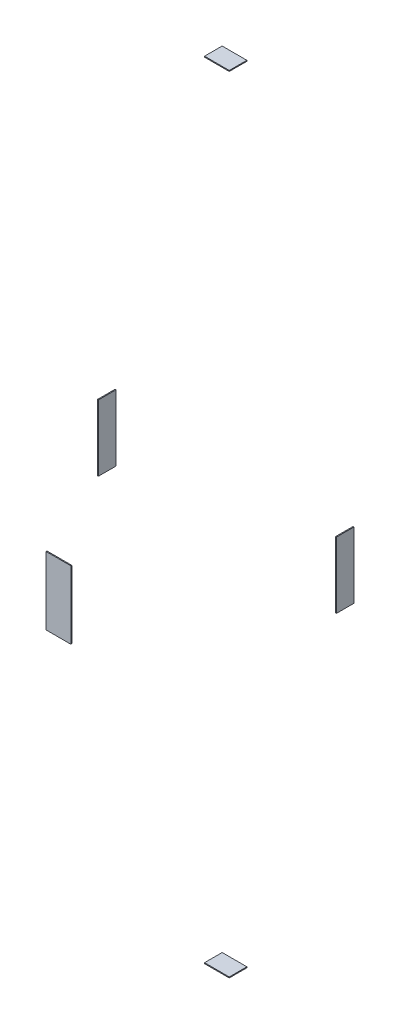
from build123d import *

# Parameters (mm, degrees)
SKETCH1_W            = 400
SKETCH1_H            = 300
BOSS_EXTRUDE1_DEPTH  = 1100
SHELL1_T             = -15
SPLIT2_START         = -6167.732568069
SPLIT2_OUTLINE_W     = 15
SPLIT2_OUTLINE_H     = 285
SPLIT2_DEPTH         = 1100
SPLIT2_2_OUTLINE_W   = 385
SPLIT2_2_OUTLINE_H   = 285
SPLIT2_2_DEPTH       = 15
SPLIT2_START_2       = -5082.732568069
SPLIT2_3_OUTLINE_W   = 385
SPLIT2_3_OUTLINE_H   = 285
SPLIT2_3_DEPTH       = 15
SPLIT2_START_3       = -6152.732568069
SPLIT2_4_OUTLINE_W   = 15
SPLIT2_4_OUTLINE_H   = 285
SPLIT2_4_DEPTH       = 1070
SPLIT2_5_OUTLINE_W   = 400
SPLIT2_5_OUTLINE_H   = 285
SPLIT2_5_DEPTH       = 15
SPLIT2_6_OUTLINE_W   = 400
SPLIT2_6_OUTLINE_H   = 285
SPLIT2_6_DEPTH       = 15
SCALE1_START         = -6275.660190895
SCALE1_OUTLINE_W     = 400
SCALE1_OUTLINE_H     = 285
SCALE1_OUTLINE_W_2   = 40
SCALE1_OUTLINE_H_2   = 28.5
SCALE1_OUTLINE_W_3   = 1.5
SCALE1_OUTLINE_H_3   = 15
SCALE1_OUTLINE_H_4   = 1.5
SCALE1_DEPTH         = 1286.002924444
SCALE1_START_2       = -6267.410190895
SCALE1_2_OUTLINE_W   = 1.5
SCALE1_2_OUTLINE_H   = 28.5
SCALE1_2_OUTLINE_W_2 = 40
SCALE1_2_OUTLINE_H_2 = 1.5
SCALE1_2_DEPTH       = 594.677622826
SCALE1_START_3       = -5562.732568069
SCALE1_3_OUTLINE_W   = 1.5
SCALE1_3_OUTLINE_H   = 28.5
SCALE1_3_OUTLINE_W_2 = 40
SCALE1_3_OUTLINE_H_2 = 1.5
SCALE1_3_DEPTH       = 564.825301618
SCALE1_4_OUTLINE_W   = 1.5
SCALE1_4_OUTLINE_H   = 28.5
SCALE1_4_OUTLINE_W_2 = 40
SCALE1_4_DEPTH       = 6.75
SCALE1_START_4       = -4996.407266451
SCALE1_5_OUTLINE_W   = 1.5
SCALE1_5_OUTLINE_H   = 28.5
SCALE1_5_OUTLINE_W_2 = 40
SCALE1_5_DEPTH       = 6.75
SCALE1_START_5       = -6268.910190895
SCALE1_6_OUTLINE_W   = 1.5
SCALE1_6_OUTLINE_H   = 28.5
SCALE1_6_DEPTH       = 597.677622826
SCALE1_START_6       = -5564.232568069
SCALE1_7_OUTLINE_W   = 1.5
SCALE1_7_OUTLINE_H   = 28.5
SCALE1_7_DEPTH       = 567.825301618


# Read off the part's stored shape, not the designer's step: Split2, Scale1
with BuildPart() as part:
    # Sketch1 → Boss-Extrude1 (new body)
    with BuildSketch(Plane(origin=(0, -6167.732568069, 0), x_dir=(1, 0, 0), z_dir=(0, 1, 0))):
        with Locations((-588.349422114, 459.224669701)):
            Rectangle(SKETCH1_W, SKETCH1_H)
    extrude(amount=BOSS_EXTRUDE1_DEPTH)

    # Shell1
    shell1_openings = [part.faces().sort_by_distance(p)[0] for p in [
        (-588.349422114, -5617.732568069, -609.224669701),
    ]]
    offset(amount=SHELL1_T, openings=shell1_openings, kind=Kind.INTERSECTION)


with BuildPart() as body_2:
    # Split1: the piece on the far side of the plane
    add(part.part)
    split(bisect_by=Plane(origin=(0, 0, -324.224669701), x_dir=(-1, 0, 0), z_dir=(0, 0, -1)), keep=Keep.BOTTOM)


with BuildPart() as part_1:
    add(part.part)

    # Split1
    split(bisect_by=Plane(origin=(0, 0, -324.224669701), x_dir=(-1, 0, 0), z_dir=(0, 0, -1)), keep=Keep.TOP)

    # Split2 outline → Split2 (cut)
    with BuildSketch(Plane(origin=(0, 0, 0), x_dir=(1, 0, 0), z_dir=(0, 1, 0)).offset(SPLIT2_START)):
        with Locations((-395.849422114, 466.724669701)):
            Rectangle(SPLIT2_OUTLINE_W, SPLIT2_OUTLINE_H)
    extrude(amount=SPLIT2_DEPTH, mode=Mode.SUBTRACT)

    # Split2 2 outline → Split2 2 (cut)
    with BuildSketch(Plane(origin=(0, 0, 0), x_dir=(1, 0, 0), z_dir=(0, 1, 0)).offset(SPLIT2_START)):
        with Locations((-595.849422114, 466.724669701)):
            Rectangle(SPLIT2_2_OUTLINE_W, SPLIT2_2_OUTLINE_H)
    extrude(amount=SPLIT2_2_DEPTH, mode=Mode.SUBTRACT)

    # Split2 3 outline → Split2 3 (cut)
    with BuildSketch(Plane(origin=(0, 0, 0), x_dir=(1, 0, 0), z_dir=(0, 1, 0)).offset(SPLIT2_START_2)):
        with Locations((-595.849422114, 466.724669701)):
            Rectangle(SPLIT2_3_OUTLINE_W, SPLIT2_3_OUTLINE_H)
    extrude(amount=SPLIT2_3_DEPTH, mode=Mode.SUBTRACT)


with BuildPart() as body_3:
    # Split2 4 outline → Split2 4 (new body)
    with BuildSketch(Plane(origin=(0, 0, 0), x_dir=(1, 0, 0), z_dir=(0, 1, 0)).offset(SPLIT2_START_3)):
        with Locations((-395.849422114, 466.724669701)):
            Rectangle(SPLIT2_4_OUTLINE_W, SPLIT2_4_OUTLINE_H)
    extrude(amount=SPLIT2_4_DEPTH)


with BuildPart() as body_4:
    # Split2 5 outline → Split2 5 (new body)
    with BuildSketch(Plane(origin=(0, 0, 0), x_dir=(1, 0, 0), z_dir=(0, 1, 0)).offset(SPLIT2_START)):
        with Locations((-588.349422114, 466.724669701)):
            Rectangle(SPLIT2_5_OUTLINE_W, SPLIT2_5_OUTLINE_H)
    extrude(amount=SPLIT2_5_DEPTH)


with BuildPart() as body_5:
    # Split2 6 outline → Split2 6 (new body)
    with BuildSketch(Plane(origin=(0, 0, 0), x_dir=(1, 0, 0), z_dir=(0, 1, 0)).offset(SPLIT2_START_2)):
        with Locations((-588.349422114, 466.724669701)):
            Rectangle(SPLIT2_6_OUTLINE_W, SPLIT2_6_OUTLINE_H)
    extrude(amount=SPLIT2_6_DEPTH)


with BuildPart() as body_2_1:
    # Body-Move/Copy1: moved
    add(body_2.part.moved(Location((0, 0, 119.961763837))))


with BuildPart() as body_5_1:
    # Body-Move/Copy2: moved
    add(body_5.part.moved(Location((0, 78.075301619, 0))))


with BuildPart() as body_4_1:
    # Body-Move/Copy3: moved
    add(body_4.part.moved(Location((0, -107.927622826, 0))))


with BuildPart() as scale1_tool:
    # Scale1 outline → Scale1 (new body)
    # profile 1 of 2: a face of its own
    with BuildSketch(Plane(origin=(0, 0, 0), x_dir=(1, 0, 0), z_dir=(0, 1, 0)).offset(SCALE1_START)):
        with Locations((-588.349422114, 466.724669701)):
            Rectangle(SCALE1_OUTLINE_W, SCALE1_OUTLINE_H)
        with Locations((-588.349422114, 466.724669701)):
            Rectangle(SCALE1_OUTLINE_W_2, SCALE1_OUTLINE_H_2, mode=Mode.SUBTRACT)
        with Locations((-780.849422114, 466.724669701)):
            Rectangle(SCALE1_OUTLINE_W_3, SCALE1_OUTLINE_H_2, mode=Mode.SUBTRACT)
        with Locations((-395.849422114, 466.724669701)):
            Rectangle(SCALE1_OUTLINE_W_3, SCALE1_OUTLINE_H_2, mode=Mode.SUBTRACT)
    # profile 2 of 2: a face of its own
    with BuildSketch(Plane(origin=(0, 0, 0), x_dir=(1, 0, 0), z_dir=(0, 1, 0)).offset(SCALE1_START)):
        with Locations((-588.349422114, 196.762905865)):
            Rectangle(SCALE1_OUTLINE_W, SCALE1_OUTLINE_H_3)
        with Locations((-588.349422114, 196.762905865)):
            Rectangle(SCALE1_OUTLINE_W_2, SCALE1_OUTLINE_H_4, mode=Mode.SUBTRACT)
    extrude(amount=SCALE1_DEPTH)


with BuildPart() as part_2:
    add(part_1.part)

    # Scale1: cut by scale1_tool
    add(scale1_tool.part, mode=Mode.SUBTRACT)


with BuildPart() as body_2_2:
    add(body_2_1.part)

    # Scale1: cut by scale1_tool
    add(scale1_tool.part, mode=Mode.SUBTRACT)


with BuildPart() as body_3_1:
    add(body_3.part)

    # Scale1: cut by scale1_tool
    add(scale1_tool.part, mode=Mode.SUBTRACT)


with BuildPart() as body_4_2:
    add(body_4_1.part)

    # Scale1: cut by scale1_tool
    add(scale1_tool.part, mode=Mode.SUBTRACT)


with BuildPart() as body_5_2:
    add(body_5_1.part)

    # Scale1: cut by scale1_tool
    add(scale1_tool.part, mode=Mode.SUBTRACT)


with BuildPart() as scale1_2_tool:
    # Scale1 2 outline → Scale1 2 (new body)
    with BuildSketch(Plane(origin=(0, 0, 0), x_dir=(1, 0, 0), z_dir=(0, 1, 0)).offset(SCALE1_START_2)):
        with Locations((-780.849422114, 466.724669701)):
            Rectangle(SCALE1_2_OUTLINE_W, SCALE1_2_OUTLINE_H)
        with Locations((-395.849422114, 466.724669701)):
            Rectangle(SCALE1_2_OUTLINE_W, SCALE1_2_OUTLINE_H)
        with Locations((-588.349422114, 466.724669701)):
            Rectangle(SCALE1_2_OUTLINE_W_2, SCALE1_2_OUTLINE_H)
        with Locations((-588.349422114, 196.762905865)):
            Rectangle(SCALE1_2_OUTLINE_W_2, SCALE1_2_OUTLINE_H_2)
    extrude(amount=SCALE1_2_DEPTH)


with BuildPart() as part_3:
    add(part_2.part)

    # Scale1 2: cut by scale1_2_tool
    add(scale1_2_tool.part, mode=Mode.SUBTRACT)


with BuildPart() as body_2_3:
    add(body_2_2.part)

    # Scale1 2: cut by scale1_2_tool
    add(scale1_2_tool.part, mode=Mode.SUBTRACT)


with BuildPart() as body_3_2:
    add(body_3_1.part)

    # Scale1 2: cut by scale1_2_tool
    add(scale1_2_tool.part, mode=Mode.SUBTRACT)


with BuildPart() as body_4_3:
    add(body_4_2.part)

    # Scale1 2: cut by scale1_2_tool
    add(scale1_2_tool.part, mode=Mode.SUBTRACT)

    # Scale1 4 outline → Scale1 4 (cut)
    with BuildSketch(Plane(origin=(0, 0, 0), x_dir=(1, 0, 0), z_dir=(0, 1, 0)).offset(SCALE1_START)):
        with Locations((-780.849422114, 466.724669701)):
            Rectangle(SCALE1_4_OUTLINE_W, SCALE1_4_OUTLINE_H)
        with Locations((-395.849422114, 466.724669701)):
            Rectangle(SCALE1_4_OUTLINE_W, SCALE1_4_OUTLINE_H)
        with Locations((-588.349422114, 466.724669701)):
            Rectangle(SCALE1_4_OUTLINE_W_2, SCALE1_4_OUTLINE_H)
    extrude(amount=SCALE1_4_DEPTH, mode=Mode.SUBTRACT)


with BuildPart() as scale1_3_tool:
    # Scale1 3 outline → Scale1 3 (new body)
    with BuildSketch(Plane(origin=(0, 0, 0), x_dir=(1, 0, 0), z_dir=(0, 1, 0)).offset(SCALE1_START_3)):
        with Locations((-780.849422114, 466.724669701)):
            Rectangle(SCALE1_3_OUTLINE_W, SCALE1_3_OUTLINE_H)
        with Locations((-395.849422114, 466.724669701)):
            Rectangle(SCALE1_3_OUTLINE_W, SCALE1_3_OUTLINE_H)
        with Locations((-588.349422114, 466.724669701)):
            Rectangle(SCALE1_3_OUTLINE_W_2, SCALE1_3_OUTLINE_H)
        with Locations((-588.349422114, 196.762905865)):
            Rectangle(SCALE1_3_OUTLINE_W_2, SCALE1_3_OUTLINE_H_2)
    extrude(amount=SCALE1_3_DEPTH)


with BuildPart() as part_4:
    add(part_3.part)

    # Scale1 3: cut by scale1_3_tool
    add(scale1_3_tool.part, mode=Mode.SUBTRACT)


with BuildPart() as body_2_4:
    add(body_2_3.part)

    # Scale1 3: cut by scale1_3_tool
    add(scale1_3_tool.part, mode=Mode.SUBTRACT)


with BuildPart() as body_3_3:
    add(body_3_2.part)

    # Scale1 3: cut by scale1_3_tool
    add(scale1_3_tool.part, mode=Mode.SUBTRACT)


with BuildPart() as body_5_3:
    add(body_5_2.part)

    # Scale1 3: cut by scale1_3_tool
    add(scale1_3_tool.part, mode=Mode.SUBTRACT)

    # Scale1 5 outline → Scale1 5 (cut)
    with BuildSketch(Plane(origin=(0, 0, 0), x_dir=(1, 0, 0), z_dir=(0, 1, 0)).offset(SCALE1_START_4)):
        with Locations((-780.849422114, 466.724669701)):
            Rectangle(SCALE1_5_OUTLINE_W, SCALE1_5_OUTLINE_H)
        with Locations((-395.849422114, 466.724669701)):
            Rectangle(SCALE1_5_OUTLINE_W, SCALE1_5_OUTLINE_H)
        with Locations((-588.349422114, 466.724669701)):
            Rectangle(SCALE1_5_OUTLINE_W_2, SCALE1_5_OUTLINE_H)
    extrude(amount=SCALE1_5_DEPTH, mode=Mode.SUBTRACT)


with BuildPart() as scale1_6_tool:
    # Scale1 6 outline → Scale1 6 (new body)
    with BuildSketch(Plane(origin=(0, 0, 0), x_dir=(1, 0, 0), z_dir=(0, 1, 0)).offset(SCALE1_START_5)):
        with Locations((-780.849422114, 466.724669701)):
            Rectangle(SCALE1_6_OUTLINE_W, SCALE1_6_OUTLINE_H)
        with Locations((-395.849422114, 466.724669701)):
            Rectangle(SCALE1_6_OUTLINE_W, SCALE1_6_OUTLINE_H)
    extrude(amount=SCALE1_6_DEPTH)


with BuildPart() as part_5:
    add(part_4.part)

    # Scale1 6: cut by scale1_6_tool
    add(scale1_6_tool.part, mode=Mode.SUBTRACT)


with BuildPart() as body_3_4:
    add(body_3_3.part)

    # Scale1 6: cut by scale1_6_tool
    add(scale1_6_tool.part, mode=Mode.SUBTRACT)


with BuildPart() as body_4_4:
    add(body_4_3.part)

    # Scale1 6: cut by scale1_6_tool
    add(scale1_6_tool.part, mode=Mode.SUBTRACT)


with BuildPart() as scale1_7_tool:
    # Scale1 7 outline → Scale1 7 (new body)
    with BuildSketch(Plane(origin=(0, 0, 0), x_dir=(1, 0, 0), z_dir=(0, 1, 0)).offset(SCALE1_START_6)):
        with Locations((-780.849422114, 466.724669701)):
            Rectangle(SCALE1_7_OUTLINE_W, SCALE1_7_OUTLINE_H)
        with Locations((-395.849422114, 466.724669701)):
            Rectangle(SCALE1_7_OUTLINE_W, SCALE1_7_OUTLINE_H)
    extrude(amount=SCALE1_7_DEPTH)


with BuildPart() as part_6:
    add(part_5.part)

    # Scale1 7: cut by scale1_7_tool
    add(scale1_7_tool.part, mode=Mode.SUBTRACT)


with BuildPart() as body_3_5:
    add(body_3_4.part)

    # Scale1 7: cut by scale1_7_tool
    add(scale1_7_tool.part, mode=Mode.SUBTRACT)


with BuildPart() as body_5_4:
    add(body_5_3.part)

    # Scale1 7: cut by scale1_7_tool
    add(scale1_7_tool.part, mode=Mode.SUBTRACT)


solid = Compound([body_2_4.part, body_4_4.part, part_6.part, body_3_5.part, body_5_4.part])
